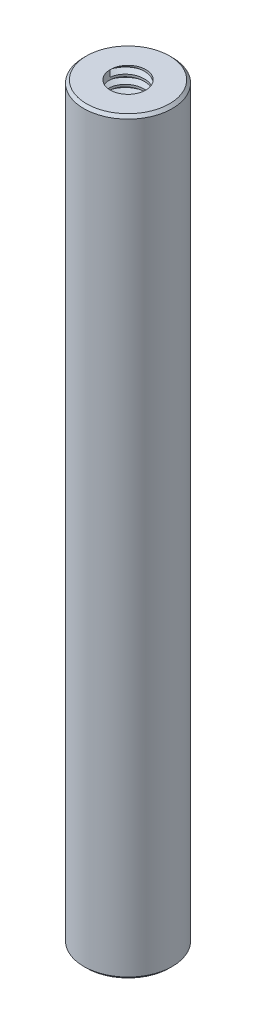
from build123d import *
from build123d.topology import SkipClean

# Parameters (mm, degrees)
CROQUIS2_R              = 6.35
SALIENTE_EXTRUIR1_DEPTH = 53.690650048
CHAFL_N1_SIZE           = 0.396875
TAP_START               = 53.69065
CROQUIS3_R              = 2.5527
TAP_HOLE_1_DEPTH        = 19.05
TAP_START_2             = -34.64065
CROQUIS3_2_R            = 2.5527
TAP_HOLE_2_DEPTH        = 19.05
ROSCA1_PITCH            = 1.27
ROSCA2_PITCH            = 1.27


with BuildPart() as part:
    # Croquis2 → Saliente-Extruir1 (new, symmetric)
    with BuildSketch(Plane(origin=(0, 0, 0), x_dir=(1, 0, 0), z_dir=(0, 1, 0))):
        with Locations(Location((0, 0, 0), (0, 0, 90))):
            Circle(CROQUIS2_R)
    extrude(amount=SALIENTE_EXTRUIR1_DEPTH, both=True)

    # Chaflán1
    chafl_n1_edges = [part.edges().sort_by_distance(p)[0] for p in [
        (0, -53.690650048, 6.35),
        (0, 53.690650048, 6.35),
    ]]
    chamfer(chafl_n1_edges, length=CHAFL_N1_SIZE)

    # Croquis3 → Tap Hole 1 (cut)
    with BuildSketch(Plane(origin=(0, 0, 0), x_dir=(1, 0, 0), z_dir=(0, 1, 0)).offset(TAP_START)):
        with Locations(Location((0, 0, 0), (0, 0, 270))):
            Circle(CROQUIS3_R)
    extrude(amount=-TAP_HOLE_1_DEPTH, mode=Mode.SUBTRACT)

    # Croquis3<2> → Tap Hole 2 (cut)
    with BuildSketch(Plane(origin=(0, 0, 0), x_dir=(1, 0, 0), z_dir=(0, 1, 0)).offset(TAP_START_2)):
        with Locations(Location((0, 0, 0), (0, 0, 270))):
            Circle(CROQUIS3_2_R)
    extrude(amount=-TAP_HOLE_2_DEPTH, mode=Mode.SUBTRACT)

    # Rosca1: the profile of Perfil de rosca1 profile screwed along a right-hand helix of 15 turns, 8 arcs to a turn; built about Z, then put on its axis
    with SkipClean():  # the faces are left unmerged after this step: merging them gives an invalid solid
        rosca1_z = Axis((0, 0, 0), (0, 0, 1))
        rosca1_corners = [(2.5524, 0, -0.000173205), (3.240107661, 0, 0.396874998), (3.240107661, 0, 0.555624998), (2.5524, 0, 0.952673202)]
        with BuildLine(mode=Mode.PRIVATE) as rosca1_profile:
            Line(rosca1_corners[0], rosca1_corners[1])
            Line(rosca1_corners[1], rosca1_corners[2])
            Line(rosca1_corners[2], rosca1_corners[3])
            Line(rosca1_corners[3], rosca1_corners[0])
        rosca1_cap = Face(rosca1_profile.wire())
        rosca1_turn_angles = [0, 22.5, 45, 67.5, 90, 112.5, 135, 157.5, 180, 202.5, 225, 247.5, 270, 292.5, 315, 337.5, 360]
        rosca1_turn_weights = [1, 0.9238795325112867, 1, 0.9238795325112867, 1, 0.9238795325112867, 1, 0.9238795325112867, 1, 0.9238795325112867, 1, 0.9238795325112867, 1, 0.9238795325112867, 1, 0.9238795325112867, 1]
        rosca1_turn_rails = [Edge.make_bspline([Vector(p[0], p[1], 0).rotate(rosca1_z, rosca1_turn_angles[k]) / rosca1_turn_weights[k] + Vector(0, 0, p[2] + ROSCA1_PITCH * rosca1_turn_angles[k] / 360) for k in range(17)], [0, 0, 0, 1, 1, 2, 2, 3, 3, 4, 4, 5, 5, 6, 6, 7, 7, 8, 8, 8], 2, rosca1_turn_weights) for p in rosca1_corners]
        rosca1_turn_sides = [Face.make_surface_from_curves(rosca1_turn_rails[p[0]], rosca1_turn_rails[p[1]]) for p in [(0, 1), (1, 2), (2, 3), (3, 0)]]
        rosca1 = Plane(origin=(0, 53.690650048, 0), x_dir=(-1, 0, 0), z_dir=(0, -1, 0)) * Solid(Shell([*[p.moved(Location((0, 0, ROSCA1_PITCH * i))) for i in range(15) for p in rosca1_turn_sides], rosca1_cap, rosca1_cap.rotate(rosca1_z, 5400).moved(Location((0, 0, ROSCA1_PITCH * 5400 / 360)))]))
        add(rosca1, mode=Mode.SUBTRACT)

    # Rosca2: the profile of Perfil de rosca2 profile screwed along a right-hand helix of 15 turns, 8 arcs to a turn; built about Z, then put on its axis
    with SkipClean():  # the faces are left unmerged after this step: merging them gives an invalid solid
        rosca2_z = Axis((0, 0, 0), (0, 0, 1))
        rosca2_corners = [(2.5524, 0, -0.000173205), (3.240107661, 0, 0.396874998), (3.240107661, 0, 0.555624998), (2.5524, 0, 0.952673202)]
        with BuildLine(mode=Mode.PRIVATE) as rosca2_profile:
            Line(rosca2_corners[0], rosca2_corners[1])
            Line(rosca2_corners[1], rosca2_corners[2])
            Line(rosca2_corners[2], rosca2_corners[3])
            Line(rosca2_corners[3], rosca2_corners[0])
        rosca2_cap = Face(rosca2_profile.wire())
        rosca2_turn_angles = [0, 22.5, 45, 67.5, 90, 112.5, 135, 157.5, 180, 202.5, 225, 247.5, 270, 292.5, 315, 337.5, 360]
        rosca2_turn_weights = [1, 0.9238795325112867, 1, 0.9238795325112867, 1, 0.9238795325112867, 1, 0.9238795325112867, 1, 0.9238795325112867, 1, 0.9238795325112867, 1, 0.9238795325112867, 1, 0.9238795325112867, 1]
        rosca2_turn_rails = [Edge.make_bspline([Vector(p[0], p[1], 0).rotate(rosca2_z, rosca2_turn_angles[k]) / rosca2_turn_weights[k] + Vector(0, 0, p[2] + ROSCA2_PITCH * rosca2_turn_angles[k] / 360) for k in range(17)], [0, 0, 0, 1, 1, 2, 2, 3, 3, 4, 4, 5, 5, 6, 6, 7, 7, 8, 8, 8], 2, rosca2_turn_weights) for p in rosca2_corners]
        rosca2_turn_sides = [Face.make_surface_from_curves(rosca2_turn_rails[p[0]], rosca2_turn_rails[p[1]]) for p in [(0, 1), (1, 2), (2, 3), (3, 0)]]
        rosca2 = Plane(origin=(0, -53.690650048, 0), x_dir=(1, 0, 0), z_dir=(0, 1, 0)) * Solid(Shell([*[p.moved(Location((0, 0, ROSCA2_PITCH * i))) for i in range(15) for p in rosca2_turn_sides], rosca2_cap, rosca2_cap.rotate(rosca2_z, 5400).moved(Location((0, 0, ROSCA2_PITCH * 5400 / 360)))]))
        add(rosca2, mode=Mode.SUBTRACT)


solid = part.part
